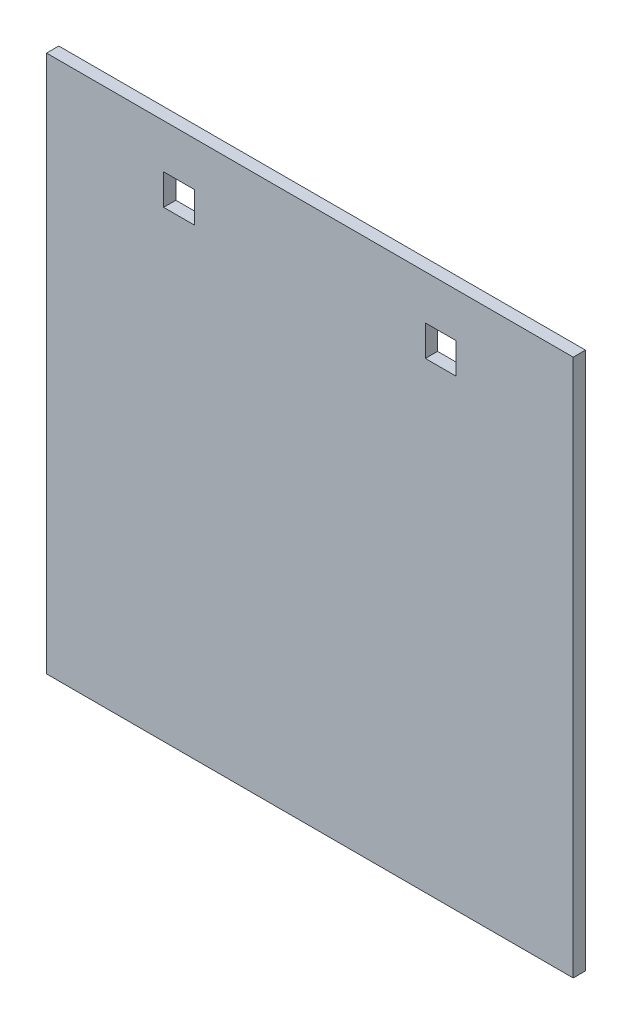
from build123d import *

# Parameters (mm, degrees)
SKETCH1_W           = 136.85
SKETCH1_H           = 139.7
BOSS_EXTRUDE1_DEPTH = 3.18
SKETCH3_R           = 1.59
SKETCH3_W           = 74.32
SKETCH3_H           = 14.625
SKETCH3_W_2         = 42.53
CUT_EXTRUDE2_DEPTH  = 10
SKETCH2_W           = 8
SKETCH2_H           = 8
CUT_EXTRUDE3_DEPTH  = 10
SKETCH4_W           = 22.756242346
SKETCH4_H           = 4.675915636
BOSS_EXTRUDE2_DEPTH = 3.18


with BuildPart() as part:
    # Sketch1 → Boss-Extrude1 (new body)
    with BuildSketch(Plane.XY):
        Rectangle(SKETCH1_W, SKETCH1_H)
    extrude(amount=BOSS_EXTRUDE1_DEPTH)

    # Sketch3 → Cut-Extrude2 (cut)
    with BuildSketch(Plane.XY.offset(3.18)):
        with Locations((15.89952905, 67.85)):
            Circle(SKETCH3_R)
        with Locations((-31.265, 77.1625)):
            Rectangle(SKETCH3_W, SKETCH3_H)
        with Locations((47.16, 77.1625)):
            Rectangle(SKETCH3_W_2, SKETCH3_H)
    extrude(amount=-CUT_EXTRUDE2_DEPTH, mode=Mode.SUBTRACT)

    # Sketch2 → Cut-Extrude3 (cut)
    with BuildSketch(Plane.XY.offset(3.18)):
        with Locations((-34, 54.35)):
            Rectangle(SKETCH2_W, SKETCH2_H)
        with Locations((34, 54.35)):
            Rectangle(SKETCH2_W, SKETCH2_H)
    extrude(amount=-CUT_EXTRUDE3_DEPTH, mode=Mode.SUBTRACT)

    # Sketch4 → Boss-Extrude2 (add)
    with BuildSketch(Plane.XY.offset(3.18)):
        with Locations((11.886675488, 67.512042182)):
            Rectangle(SKETCH4_W, SKETCH4_H)
    extrude(amount=-BOSS_EXTRUDE2_DEPTH)


solid = part.part
